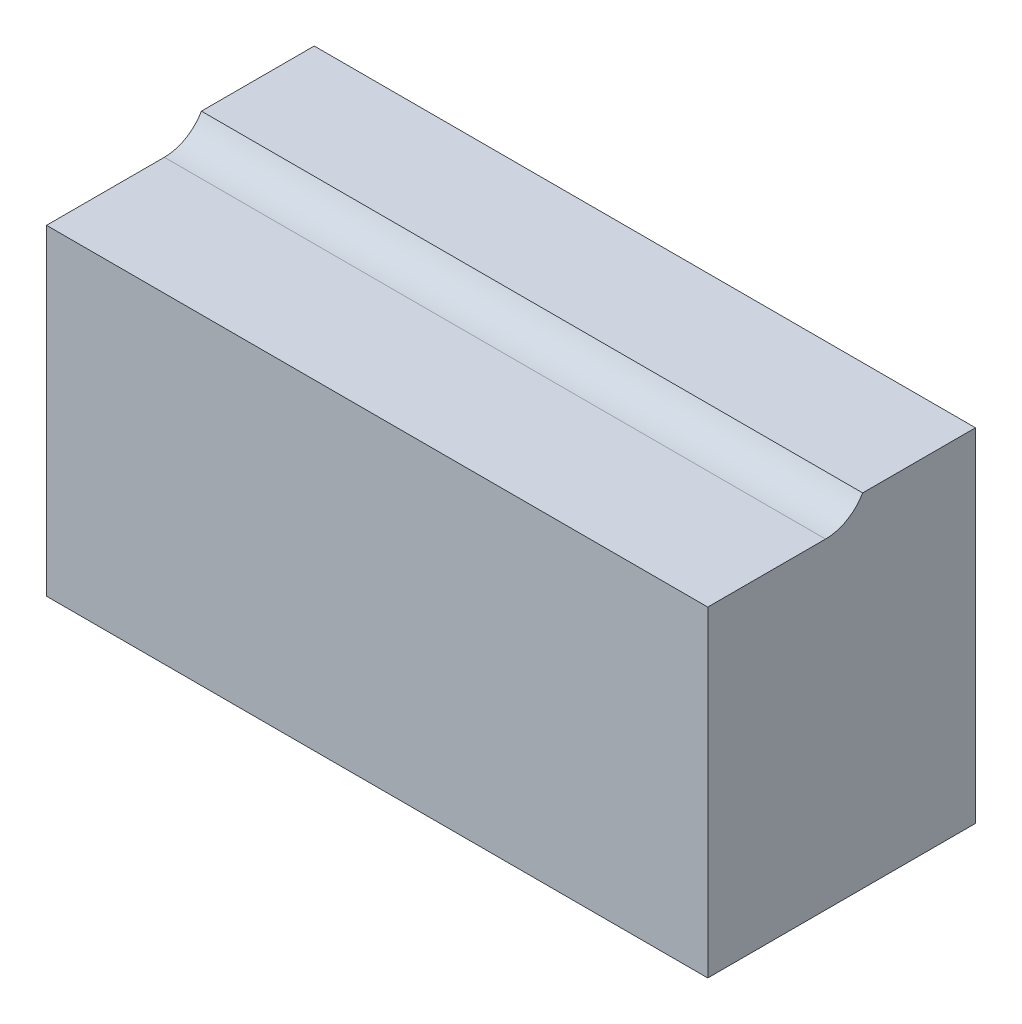
from build123d import *

# Parameters (mm, degrees)
SKETCH1_W           = 61.75
SKETCH1_H           = 38
BOSS_EXTRUDE1_DEPTH = 12.5
CUT_EXTRUDE1_REACH  = 75.575


with BuildPart() as part:
    # Sketch1 → Boss-Extrude1 (new, symmetric)
    with BuildSketch(Plane.XY):
        with Locations((36.590437788, -19)):
            Rectangle(SKETCH1_W, SKETCH1_H)
    extrude(amount=BOSS_EXTRUDE1_DEPTH, both=True)

    # Sketch2 → Cut-Extrude1 (cut, up to next)
    with BuildSketch(Plane(origin=(67.465437788, 0, 0), x_dir=(0, 0, -1), z_dir=(1, 0, 0)), mode=Mode.PRIVATE) as cut_extrude1_sk1:
        with BuildLine():
            Line((1.964101615, -6), (12.5, -6))
            Line((12.5, -6), (12.5, 0))
            Line((12.5, 0), (-12.5, 0))
            Line((-12.5, 0), (-12.5, -8))
            Line((-12.5, -8), (-1.5, -8))
            ThreePointArc((-1.5, -8), (0.5, -7.464101615), (1.964101615, -6))
        make_face()
    cut_extrude1_tool1 = extrude(cut_extrude1_sk1.sketch, amount=-CUT_EXTRUDE1_REACH, mode=Mode.PRIVATE) & part.part
    add(cut_extrude1_tool1.solids().sort_by_distance((67.465438, -3.603515, 0.874459))[0], mode=Mode.SUBTRACT)


solid = part.part
